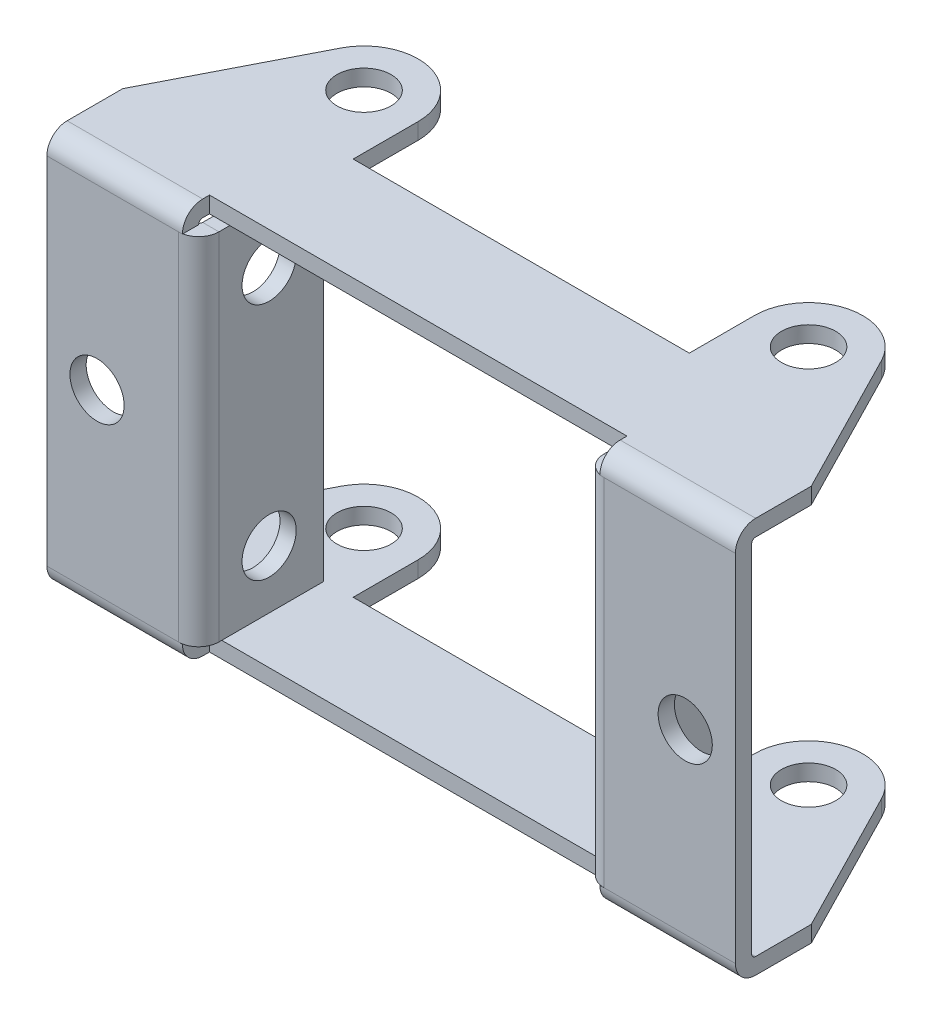
from build123d import *

# Parameters (mm, degrees)
SKETCH_1_W                         = 127
SKETCH_1_H                         = 73
SKETCH_1_R                         = 5
SM_BASE_FLANGE_1_DEPTH             = 3
SM_EDGE_FLANGE_1_STRIP_W           = 13.48
SM_EDGE_FLANGE_1_STRIP_H           = 3
SM_EDGE_FLANGE_1_STRIP_CUT_DEPTH   = 127
SM_EDGE_FLANGE_1_STRIP_2_W         = 13.48
SM_EDGE_FLANGE_1_STRIP_2_H         = 3
SM_EDGE_FLANGE_1_STRIP_CUT_2_DEPTH = 127
SM_EDGE_FLANGE_1_DEPTH             = 127
SM_EDGE_FLANGE_1_BEND_DEPTH        = 127
SKETCH_12_OUTSIDE_W                = 159.708
SKETCH_12_OUTSIDE_H                = 78.708
SKETCH_12_OUTSIDE_R                = 5
CUT_EXTRUDE_4_DEPTH                = 108.131928014
SM_EDGE_FLANGE_2_STRIP_W           = 13.48
SM_EDGE_FLANGE_2_STRIP_H           = 3
SM_EDGE_FLANGE_2_STRIP_CUT_DEPTH   = 65.52
SM_EDGE_FLANGE_2_STRIP_2_W         = 13.48
SM_EDGE_FLANGE_2_STRIP_2_H         = 3
SM_EDGE_FLANGE_2_STRIP_CUT_2_DEPTH = 65.52
SM_EDGE_FLANGE_2_DEPTH             = 65.52
SM_START                           = 3
SM_EDGE_FLANGE_2_PROFILE_W         = 65.52
SM_EDGE_FLANGE_2_PROFILE_H         = 19.26
SM_EDGE_FLANGE_2_PROFILE_R         = 5
SM_EDGE_FLANGE_2_FLAT_DEPTH        = 3
SM_EDGE_FLANGE_2_BEND_DEPTH        = 65.52
SM_EDGE_FLANGE_2_PROFILE_2_W       = 65.52
SM_EDGE_FLANGE_2_PROFILE_2_H       = 19.26
SM_EDGE_FLANGE_2_PROFILE_2_R       = 5
SM_EDGE_FLANGE_2_FLAT_2_DEPTH      = 3


# Sheet-metal steps are written as plain solids
with BuildPart() as part:
    # Sketch 1 → Базовая кромка1 (new body)
    with BuildSketch(Plane.XY):
        Rectangle(SKETCH_1_W, SKETCH_1_H)
        with Locations((-54.25, 0)):
            Circle(SKETCH_1_R, mode=Mode.SUBTRACT)
        with Locations((54.25, 0)):
            Circle(SKETCH_1_R, mode=Mode.SUBTRACT)
    extrude(amount=-SM_BASE_FLANGE_1_DEPTH)

    # Ребро-кромка1 strip (across the edge) → Ребро-кромка1 strip cut (cut)
    with BuildSketch(Plane(origin=(-63.5, 36.5, -3), x_dir=(0, -1, 0), z_dir=(1, 0, 0))):
        with Locations((-3, -1.5)):
            Rectangle(SM_EDGE_FLANGE_1_STRIP_W, SM_EDGE_FLANGE_1_STRIP_H)
    extrude(amount=SM_EDGE_FLANGE_1_STRIP_CUT_DEPTH, mode=Mode.SUBTRACT)

    # Ребро-кромка1 strip 2 (across the edge) → Ребро-кромка1 strip cut 2 (cut)
    with BuildSketch(Plane(origin=(63.5, -36.5, -3), x_dir=(0, 1, 0), z_dir=(-1, 0, 0))):
        with Locations((-3, -1.5)):
            Rectangle(SM_EDGE_FLANGE_1_STRIP_2_W, SM_EDGE_FLANGE_1_STRIP_2_H)
    extrude(amount=SM_EDGE_FLANGE_1_STRIP_CUT_2_DEPTH, mode=Mode.SUBTRACT)

    # Ребро-кромка1 section (across the edge) → Ребро-кромка1 (add)
    with BuildSketch(Plane(origin=(-63.5, 36.5, -3), x_dir=(0, -1, 0), z_dir=(1, 0, 0))):
        with BuildLine():
            Line((0, 0.74), (0, 43))
            Line((0, 43), (3, 43))
            Line((3, 43), (3, 0.74))
            ThreePointArc((3, 0.74), (3.216740982, 0.216740982), (3.74, 0))
            Line((3.74, 0), (3.74, -3))
            ThreePointArc((3.74, -3), (1.095420638, -1.904579362), (0, 0.74))
        make_face()
    extrude(amount=SM_EDGE_FLANGE_1_DEPTH)

    # Ребро-кромка1 section 2 (across the edge) → Ребро-кромка1 bend (add)
    with BuildSketch(Plane(origin=(63.5, -36.5, -3), x_dir=(0, 1, 0), z_dir=(-1, 0, 0))):
        with BuildLine():
            Line((0, 0.74), (0, 43))
            Line((0, 43), (3, 43))
            Line((3, 43), (3, 0.74))
            ThreePointArc((3, 0.74), (3.216740982, 0.216740982), (3.74, 0))
            Line((3.74, 0), (3.74, -3))
            ThreePointArc((3.74, -3), (1.095420638, -1.904579362), (0, 0.74))
        make_face()
    extrude(amount=SM_EDGE_FLANGE_1_BEND_DEPTH)

    # Эскиз12 outside → Вырез-Вытянуть4 (cut, through all)
    # profile 1 of 3: a face of its own
    with BuildSketch(Plane(origin=(0, 36.5, 0), x_dir=(1, 0, 0), z_dir=(0, 1, 0))):
        with Locations((0, 23)):
            Rectangle(SKETCH_12_OUTSIDE_W, SKETCH_12_OUTSIDE_H)
        with BuildLine():
            Line((63.5, 14), (49.900936783, 40.557776255))
            ThreePointArc((49.900936783, 40.557776255), (38.655790946, 45.721351959), (31, 36))
            Line((31, 36), (31, 24))
            Line((31, 24), (-31, 24))
            Line((-31, 24), (-31, 36))
            ThreePointArc((-31, 36), (-38.655790946, 45.721351959), (-49.900936783, 40.557776255))
            Line((-49.900936783, 40.557776255), (-63.5, 14))
            Line((-63.5, 14), (-63.5, 0))
            Line((-63.5, 0), (-38.5, 0))
            Line((-38.5, 0), (-38.5, 5))
            Line((-38.5, 5), (38.5, 5))
            Line((38.5, 5), (38.5, 0))
            Line((38.5, 0), (63.5, 0))
            Line((63.5, 0), (63.5, 14))
        make_face(mode=Mode.SUBTRACT)
    # profile 2 of 3: a face of its own
    with BuildSketch(Plane(origin=(0, 36.5, 0), x_dir=(1, 0, 0), z_dir=(0, 1, 0))):
        with Locations(Location((41, 36, 0), (0, 0, 270))):
            Circle(SKETCH_12_OUTSIDE_R)
    # profile 3 of 3: a face of its own
    with BuildSketch(Plane(origin=(0, 36.5, 0), x_dir=(1, 0, 0), z_dir=(0, 1, 0))):
        with Locations(Location((-41, 36, 0), (0, 0, 270))):
            Circle(SKETCH_12_OUTSIDE_R)
    extrude(amount=-CUT_EXTRUDE_4_DEPTH, mode=Mode.SUBTRACT)

    # Ребро-кромка2 strip (across the edge) → Ребро-кромка2 strip cut (cut)
    with BuildSketch(Plane(origin=(38.5, -32.76, -3), x_dir=(1, 0, 0), z_dir=(0, 1, 0))):
        with Locations((-6, -1.5)):
            Rectangle(SM_EDGE_FLANGE_2_STRIP_W, SM_EDGE_FLANGE_2_STRIP_H)
    extrude(amount=SM_EDGE_FLANGE_2_STRIP_CUT_DEPTH, mode=Mode.SUBTRACT)

    # Ребро-кромка2 strip 2 (across the edge) → Ребро-кромка2 strip cut 2 (cut)
    with BuildSketch(Plane(origin=(-38.5, 32.76, -3), x_dir=(-1, 0, 0), z_dir=(0, -1, 0))):
        with Locations((-6, -1.5)):
            Rectangle(SM_EDGE_FLANGE_2_STRIP_2_W, SM_EDGE_FLANGE_2_STRIP_2_H)
    extrude(amount=SM_EDGE_FLANGE_2_STRIP_CUT_2_DEPTH, mode=Mode.SUBTRACT)

    # Ребро-кромка2 bend section (across the edge) → Ребро-кромка2 (add)
    with BuildSketch(Plane(origin=(38.5, -32.76, -3), x_dir=(1, 0, 0), z_dir=(0, 1, 0))):
        with BuildLine():
            Line((-3, 0.74), (0, 0.74))
            ThreePointArc((0, 0.74), (0.216740982, 0.216740982), (0.74, 0))
            Line((0.74, 0), (0.74, -3))
            ThreePointArc((0.74, -3), (-1.904579362, -1.904579362), (-3, 0.74))
        make_face()
    extrude(amount=SM_EDGE_FLANGE_2_DEPTH)

    # Ребро-кромка2 profile (on flange) → Ребро-кромка2 flat (add)
    with BuildSketch(Plane(origin=(38.5, 0, -3), x_dir=(0, 1, 0), z_dir=(-1, 0, 0)).offset(SM_START)):
        with Locations((0, 10.37)):
            Rectangle(SM_EDGE_FLANGE_2_PROFILE_W, SM_EDGE_FLANGE_2_PROFILE_H)
        with Locations((22.031313941, 10)):
            Circle(SM_EDGE_FLANGE_2_PROFILE_R, mode=Mode.SUBTRACT)
        with Locations((-22.031313941, 10)):
            Circle(SM_EDGE_FLANGE_2_PROFILE_R, mode=Mode.SUBTRACT)
    extrude(amount=-SM_EDGE_FLANGE_2_FLAT_DEPTH)

    # Ребро-кромка2 bend section 2 (across the edge) → Ребро-кромка2 bend (add)
    with BuildSketch(Plane(origin=(-38.5, 32.76, -3), x_dir=(-1, 0, 0), z_dir=(0, -1, 0))):
        with BuildLine():
            Line((-3, 0.74), (0, 0.74))
            ThreePointArc((0, 0.74), (0.216740982, 0.216740982), (0.74, 0))
            Line((0.74, 0), (0.74, -3))
            ThreePointArc((0.74, -3), (-1.904579362, -1.904579362), (-3, 0.74))
        make_face()
    extrude(amount=SM_EDGE_FLANGE_2_BEND_DEPTH)

    # Ребро-кромка2 profile 2 (on flange) → Ребро-кромка2 flat 2 (add)
    with BuildSketch(Plane(origin=(-38.5, 0, -3), x_dir=(0, -1, 0), z_dir=(1, 0, 0)).offset(SM_START)):
        with Locations((0, 10.37)):
            Rectangle(SM_EDGE_FLANGE_2_PROFILE_2_W, SM_EDGE_FLANGE_2_PROFILE_2_H)
        with Locations((-22.031313941, 10)):
            Circle(SM_EDGE_FLANGE_2_PROFILE_2_R, mode=Mode.SUBTRACT)
        with Locations((22.031313941, 10)):
            Circle(SM_EDGE_FLANGE_2_PROFILE_2_R, mode=Mode.SUBTRACT)
    extrude(amount=-SM_EDGE_FLANGE_2_FLAT_2_DEPTH)


solid = part.part
